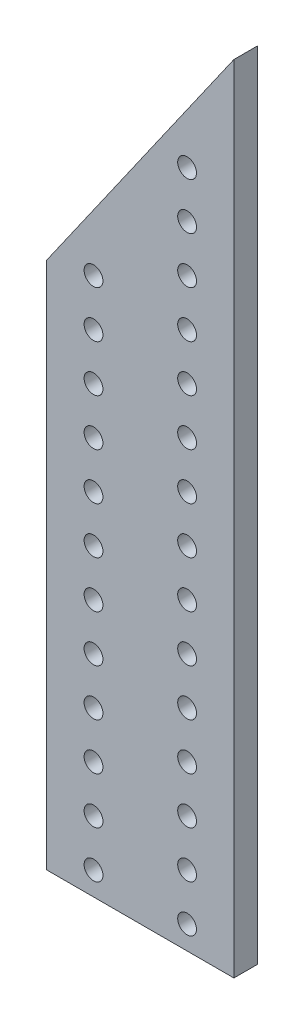
from build123d import *

# Parameters (mm, degrees)
SKETCH1_W           = 50.8
SKETCH1_H           = 215.9
BOSS_EXTRUDE1_DEPTH = 6.35
SKETCH2_R           = 2.5527
CUT_EXTRUDE1_DEPTH  = 222.886846163
CUT_EXTRUDE2_DEPTH  = 222.886846163


with BuildPart() as part:
    # Sketch1 → Boss-Extrude1 (new body)
    with BuildSketch(Plane.XY):
        with Locations((25.4, 107.95)):
            Rectangle(SKETCH1_W, SKETCH1_H)
    extrude(amount=BOSS_EXTRUDE1_DEPTH)

    # Sketch2 → Cut-Extrude1 (cut, through all)
    with BuildSketch(Plane(origin=(0, 0, 0), x_dir=(-1, 0, 0), z_dir=(0, 0, -1))):
        with Locations((-38.1, 6.35)):
            Circle(SKETCH2_R)
        with Locations((-12.7, 6.35)):
            Circle(SKETCH2_R)
        with Locations((-38.1, 19.05)):
            Circle(SKETCH2_R)
        with Locations((-12.7, 19.05)):
            Circle(SKETCH2_R)
        with Locations((-38.1, 31.75)):
            Circle(SKETCH2_R)
        with Locations((-12.7, 31.75)):
            Circle(SKETCH2_R)
        with Locations((-38.1, 44.45)):
            Circle(SKETCH2_R)
        with Locations((-12.7, 44.45)):
            Circle(SKETCH2_R)
        with Locations((-38.1, 57.15)):
            Circle(SKETCH2_R)
        with Locations((-12.7, 57.15)):
            Circle(SKETCH2_R)
        with Locations((-38.1, 69.85)):
            Circle(SKETCH2_R)
        with Locations((-12.7, 69.85)):
            Circle(SKETCH2_R)
        with Locations((-38.1, 82.55)):
            Circle(SKETCH2_R)
        with Locations((-12.7, 82.55)):
            Circle(SKETCH2_R)
        with Locations((-38.1, 95.25)):
            Circle(SKETCH2_R)
        with Locations((-12.7, 95.25)):
            Circle(SKETCH2_R)
        with Locations((-38.1, 107.95)):
            Circle(SKETCH2_R)
        with Locations((-12.7, 107.95)):
            Circle(SKETCH2_R)
        with Locations((-38.1, 120.65)):
            Circle(SKETCH2_R)
        with Locations((-12.7, 120.65)):
            Circle(SKETCH2_R)
        with Locations((-38.1, 133.35)):
            Circle(SKETCH2_R)
        with Locations((-12.7, 133.35)):
            Circle(SKETCH2_R)
        with Locations((-38.1, 146.05)):
            Circle(SKETCH2_R)
        with Locations((-12.7, 146.05)):
            Circle(SKETCH2_R)
        with Locations((-38.1, 158.75)):
            Circle(SKETCH2_R)
        with Locations((-38.1, 171.45)):
            Circle(SKETCH2_R)
        with Locations((-12.7, 171.45)):
            Circle(SKETCH2_R)
        with Locations((-38.1, 184.15)):
            Circle(SKETCH2_R)
    extrude(amount=-CUT_EXTRUDE1_DEPTH, mode=Mode.SUBTRACT)

    # Sketch3 → Cut-Extrude2 (cut, through all)
    with BuildSketch(Plane(origin=(0, 0, 0), x_dir=(-1, 0, 0), z_dir=(0, 0, -1))):
        Polygon((-50.8, 215.9), (0, 143.350081258), (0, 215.9), align=None)
    extrude(amount=-CUT_EXTRUDE2_DEPTH, mode=Mode.SUBTRACT)


solid = part.part
